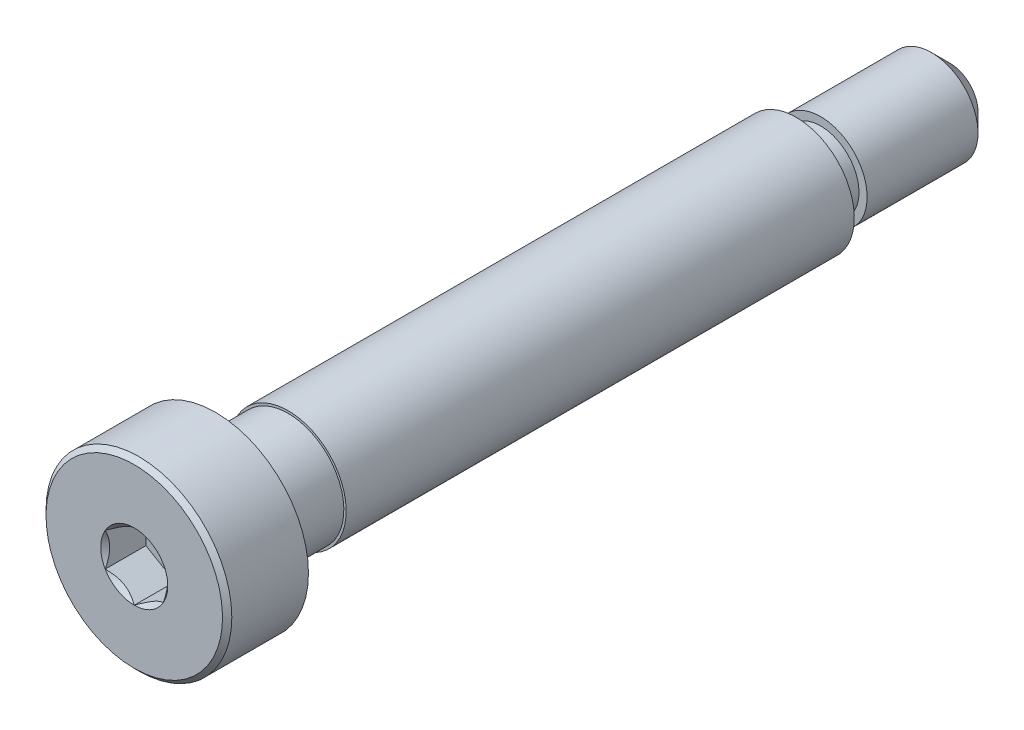
from build123d import *

# Parameters (mm, degrees)
CUT_EXTRUDE1_START = 35.1165
CUT_EXTRUDE1_DEPTH = 3.5
CHAMFER2_SIZE      = 1.578938402


# Read off the part's stored shape, not the designer's step: Cut-Revolve-Thin1
with BuildPart() as part:
    # Sketch3 → Revolve1 (revolve)
    with BuildSketch(Plane(origin=(0, 0, 0), x_dir=(0, 0, -1), z_dir=(1, 0, 0)), mode=Mode.PRIVATE) as revolve1_sk:
        with BuildLine():
            Line((-35.1165, 0), (-35.1165, 7.48))
            Line((-35.1165, 7.48), (-35.1165, 8))
            Line((-35.1165, 8), (-28.6365, 8))
            Line((-28.6365, 8), (-28.1165, 8))
            Line((-28.1165, 8), (-28.1165, 4.797))
            Line((-28.1165, 4.797), (-21.8665, 4.797))
            Line((-21.8665, 4.797), (-21.8665, 5))
            Line((-21.8665, 5), (21.8835, 5))
            Line((21.8835, 5), (21.8835, 3.650794))
            ThreePointArc((21.8835, 3.650794), (21.985780069, 3.403868069), (22.232706, 3.301588))
            Line((22.232706, 3.301588), (23.988751203, 3.301588))
            Line((23.988751203, 3.301588), (23.988751203, 4))
            Line((23.988751203, 4), (34.179, 4))
            Line((34.179, 4), (35.1165, 4))
            Line((35.1165, 4), (35.1165, 0))
            Line((35.1165, 0), (-35.1165, 0))
        make_face()
    revolve(revolve1_sk.sketch.rotate(Axis((0, 0, 35.1165), (0, 0, -1)), 180), axis=Axis((0, 0, 35.1165), (0, 0, -1)))

    # Cut-Revolve-Thin1 outline → Cut-Revolve-Thin1 (revolve, cut)
    with BuildSketch(Plane.XZ):
        Polygon((4.75890632, 21.867193958), (3.96190632, -21.882806042), (4, -21.8835), (4.797, 21.8665), align=None)
    revolve(axis=Axis((0, 0, 0), (0, 0, 1)), mode=Mode.SUBTRACT)

    # Sketch4 → Cut-Extrude1 (cut)
    with BuildSketch(Plane.XY.offset(CUT_EXTRUDE1_START)):
        Polygon((0, 2.886751346), (-2.5, 1.443375673), (-2.5, -1.443375673), (0, -2.886751346), (2.5, -1.443375673), (2.5, 1.443375673), align=None)
    extrude(amount=-CUT_EXTRUDE1_DEPTH, mode=Mode.SUBTRACT)

    # Cut-Extrude2 cone 1 section (through the dimple's axis) → Cut-Extrude2 (revolve, cut)
    with BuildSketch(Plane(origin=(0, 0, 35.1165), x_dir=(0, -1, 0), z_dir=(1, 0, 0))):
        Polygon((0, 0), (2.886751346, 0), (0, 2.886751346), align=None)
    revolve(axis=Axis((0, 0, 35.1165), (0, 0, -1)), mode=Mode.SUBTRACT)

    # Chamfer2
    chamfer2_edges = [part.edges().sort_by_distance(p)[0] for p in [
        (0, 4, -35.1165),
    ]]
    chamfer(chamfer2_edges, length=CHAMFER2_SIZE)

    # Sketch10 → Cut-Revolve2 (revolve, cut)
    with BuildSketch(Plane(origin=(0, 0, 0), x_dir=(0, 0, -1), z_dir=(1, 0, 0)), mode=Mode.PRIVATE) as cut_revolve2_sk:
        Polygon((-35.1165, 7.6), (-34.7165, 8), (-35.1165, 8), align=None)
    revolve(cut_revolve2_sk.sketch.rotate(Axis((0, 0, 35.1165), (0, 0, -1)), 180), axis=Axis((0, 0, 35.1165), (0, 0, -1)), mode=Mode.SUBTRACT)


solid = part.part
